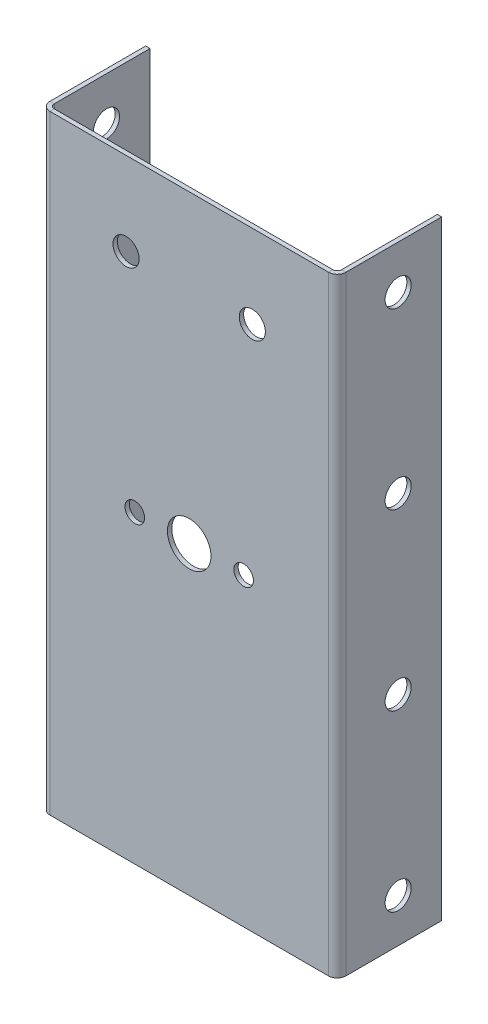
from build123d import *

# Parameters (mm, degrees)
BRIDA_BASE1_DEPTH     = 70
CROQUIS5_R            = 2.5
CROQUIS5_R_2          = 1.125
CROQUIS5_R_3          = 1.5
CORTAR_EXTRUIR1_DEPTH = 10
CROQUIS6_R            = 1.5
CORTAR_EXTRUIR3_DEPTH = 79.74007874


# Sheet-metal steps are written as plain solids
with BuildPart() as part:
    # Croquis1 → Brida base1 (new body)
    with BuildSketch(Plane(origin=(0, 0, 0), x_dir=(1, 0, 0), z_dir=(0, 1, 0))):
        with BuildLine():
            Line((-12.180744501, 12), (-12.180744501, 1))
            ThreePointArc((-12.180744501, 1), (-11.887851282, 0.292893219), (-11.180744501, 0))
            Line((-11.180744501, 0), (20.819255499, 0))
            ThreePointArc((20.819255499, 0), (21.52636228, 0.292893219), (21.819255499, 1))
            Line((21.819255499, 1), (21.819255499, 12))
            Line((21.819255499, 12), (21.319255499, 12))
            Line((21.319255499, 12), (21.319255499, 1))
            ThreePointArc((21.319255499, 1), (21.17280889, 0.646446609), (20.819255499, 0.5))
            Line((20.819255499, 0.5), (-11.180744501, 0.5))
            ThreePointArc((-11.180744501, 0.5), (-11.534297891, 0.646446609), (-11.680744501, 1))
            Line((-11.680744501, 1), (-11.680744501, 12))
            Line((-11.680744501, 12), (-12.180744501, 12))
        make_face()
    extrude(amount=BRIDA_BASE1_DEPTH)

    # Croquis5 → Cortar-Extruir1 (cut)
    with BuildSketch(Plane.XY):
        with Locations((4.819255499, 35)):
            Circle(CROQUIS5_R)
        with Locations((-1.430744501, 35)):
            Circle(CROQUIS5_R_2)
        with Locations(Location((11.069255499, 35, 0), (0, 0, 180))):
            Circle(CROQUIS5_R_2)
        with Locations((-2.430744501, 60.4433725)):
            Circle(CROQUIS5_R_3)
        with Locations(Location((12.069255499, 60.4433725, 0), (0, 0, 180))):
            Circle(CROQUIS5_R_3)
    extrude(amount=-CORTAR_EXTRUIR1_DEPTH, mode=Mode.SUBTRACT)

    # Croquis6 → Cortar-Extruir3 (cut, through all)
    with BuildSketch(Plane.ZY.offset(12.180744501)):
        with Locations(Location((-7, 45, 0), (0, 0, 180))):
            Circle(CROQUIS6_R)
        with Locations((-7, 25)):
            Circle(CROQUIS6_R)
        with Locations((-7, 5)):
            Circle(CROQUIS6_R)
        with Locations(Location((-7, 65, 0), (0, 0, 180))):
            Circle(CROQUIS6_R)
    extrude(amount=-CORTAR_EXTRUIR3_DEPTH, mode=Mode.SUBTRACT)


solid = part.part
